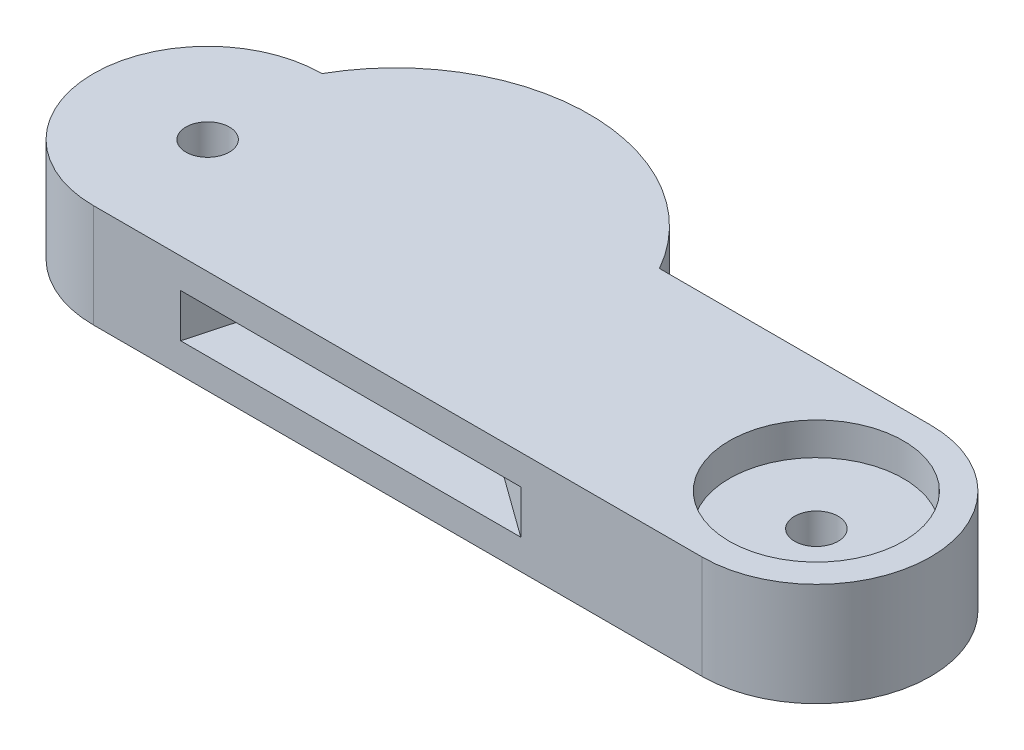
from build123d import *

# Parameters (mm, degrees)
SKETCH1_R                       = 2
BOSS_EXTRUDE1_DEPTH             = 4.75
CUT_EXTRUDE1_DEPTH              = 2
BOSS_EXTRUDE2_REACH             = 69.423
BOSS_EXTRUDE2_DIRECTION_2_REACH = 69.423
CUT_EXTRUDE2_DEPTH              = 2
SKETCH7_R                       = 8
CUT_EXTRUDE3_DEPTH              = 3


with BuildPart() as part:
    # Sketch1 → Boss-Extrude1 (new, symmetric)
    with BuildSketch(Plane(origin=(0, 0, 0), x_dir=(1, 0, 0), z_dir=(0, 1, 0))):
        with BuildLine():
            Line((0, -10.500399217), (-55.93053828, -10.500399217))
            ThreePointArc((-55.93053828, -10.500399217), (-66.430937497, 0), (-55.93053828, 10.500399217))
            Line((-55.93053828, 10.500399217), (0, 10.500399217))
            ThreePointArc((0, 10.500399217), (10.500399217, 0), (0, -10.500399217))
        make_face()
        Circle(SKETCH1_R, mode=Mode.SUBTRACT)
        with Locations((-55.93053828, 0)):
            Circle(SKETCH1_R, mode=Mode.SUBTRACT)
    extrude(amount=BOSS_EXTRUDE1_DEPTH, both=True)

    # Sketch3 → Cut-Extrude1 (cut, symmetric)
    with BuildSketch(Plane(origin=(0, 0, 0), x_dir=(1, 0, 0), z_dir=(0, 1, 0))):
        with BuildLine():
            Line((-35.751827911, 18.875253657), (-39.299525946, 5.868950542))
            Line((-39.299525946, 5.868950542), (26.645239155, -41.810424095))
            ThreePointArc((26.645239155, -41.810424095), (-18.563858299, -45.972421055), (-48.206523525, -11.584965354))
            Line((-48.206523525, -11.584965354), (-43.887265107, 4.249974277))
            Line((-43.887265107, 4.249974277), (-54.812276631, 12.148974547))
            ThreePointArc((-54.812276631, 12.148974547), (-46.585078234, 19.204535889), (-35.751827911, 18.875253657))
        make_face()
    extrude(amount=CUT_EXTRUDE1_DEPTH, both=True, mode=Mode.SUBTRACT)

    # Boss-Extrude2: up to this face of the body (flat: up to its plane)
    boss_extrude2_end = Plane(part.part.faces().sort_by_distance((-27.96526914, 4.75, 0))[0])
    # Sketch5 → Boss-Extrude2 (add, up to the picked face)
    with BuildSketch(Plane(origin=(0, 0, 0), x_dir=(1, 0, 0), z_dir=(0, 1, 0)), mode=Mode.PRIVATE) as boss_extrude2_sk1:
        with BuildLine():
            ThreePointArc((-24.917700351, 10.500399217), (-40.424119316, 19.553005923), (-55.93053828, 10.500399217))
            Line((-55.93053828, 10.500399217), (-24.917700351, 10.500399217))
        make_face()
    boss_extrude2_tool1 = split(extrude(boss_extrude2_sk1.sketch, amount=BOSS_EXTRUDE2_REACH, mode=Mode.PRIVATE), bisect_by=boss_extrude2_end, keep=Keep.BOTH, mode=Mode.PRIVATE)
    add(boss_extrude2_tool1.solids().sort_by(Axis((-40.424119, 0, -14.214125), (0, 1, 0)))[0])

    # Boss-Extrude2 direction 2: up to this face of the body (flat: up to its plane)
    boss_extrude2_direction_2_end = Plane(part.part.faces().sort_by_distance((-27.96526914, -4.75, 0))[0])
    # Sketch5 → Boss-Extrude2 direction 2 (add, up to the picked face)
    with BuildSketch(Plane(origin=(0, 0, 0), x_dir=(1, 0, 0), z_dir=(0, 1, 0)), mode=Mode.PRIVATE) as boss_extrude2_direction_2_sk1:
        with BuildLine():
            ThreePointArc((-24.917700351, 10.500399217), (-40.424119316, 19.553005923), (-55.93053828, 10.500399217))
            Line((-55.93053828, 10.500399217), (-24.917700351, 10.500399217))
        make_face()
    boss_extrude2_direction_2_tool1 = split(extrude(boss_extrude2_direction_2_sk1.sketch, amount=-BOSS_EXTRUDE2_DIRECTION_2_REACH, mode=Mode.PRIVATE), bisect_by=boss_extrude2_direction_2_end, keep=Keep.BOTH, mode=Mode.PRIVATE)
    add(boss_extrude2_direction_2_tool1.solids().sort_by(Axis((-40.424119, 0, -14.214125), (0, -1, 0)))[0])

    # Sketch6 → Cut-Extrude2 (cut, symmetric)
    with BuildSketch(Plane(origin=(0, 0, 0), x_dir=(1, 0, 0), z_dir=(0, 1, 0))):
        with BuildLine():
            Line((-39.299525946, 5.868950542), (-16.659276721, -10.500399217))
            Line((-16.659276721, -10.500399217), (-47.910689027, -10.500399217))
            Line((-47.910689027, -10.500399217), (-43.887265107, 4.249974277))
            Line((-43.887265107, 4.249974277), (-54.854382526, 12.179417945))
            ThreePointArc((-54.854382526, 12.179417945), (-46.349897212, 18.538096729), (-35.738154791, 18.925381021))
            Line((-35.738154791, 18.925381021), (-39.299525946, 5.868950542))
        make_face()
    extrude(amount=CUT_EXTRUDE2_DEPTH, both=True, mode=Mode.SUBTRACT)

    # Sketch7 → Cut-Extrude3 (cut)
    with BuildSketch(Plane(origin=(0, 4.75, 0), x_dir=(1, 0, 0), z_dir=(0, 1, 0))):
        Circle(SKETCH7_R)
    extrude(amount=-CUT_EXTRUDE3_DEPTH, mode=Mode.SUBTRACT)


solid = part.part
